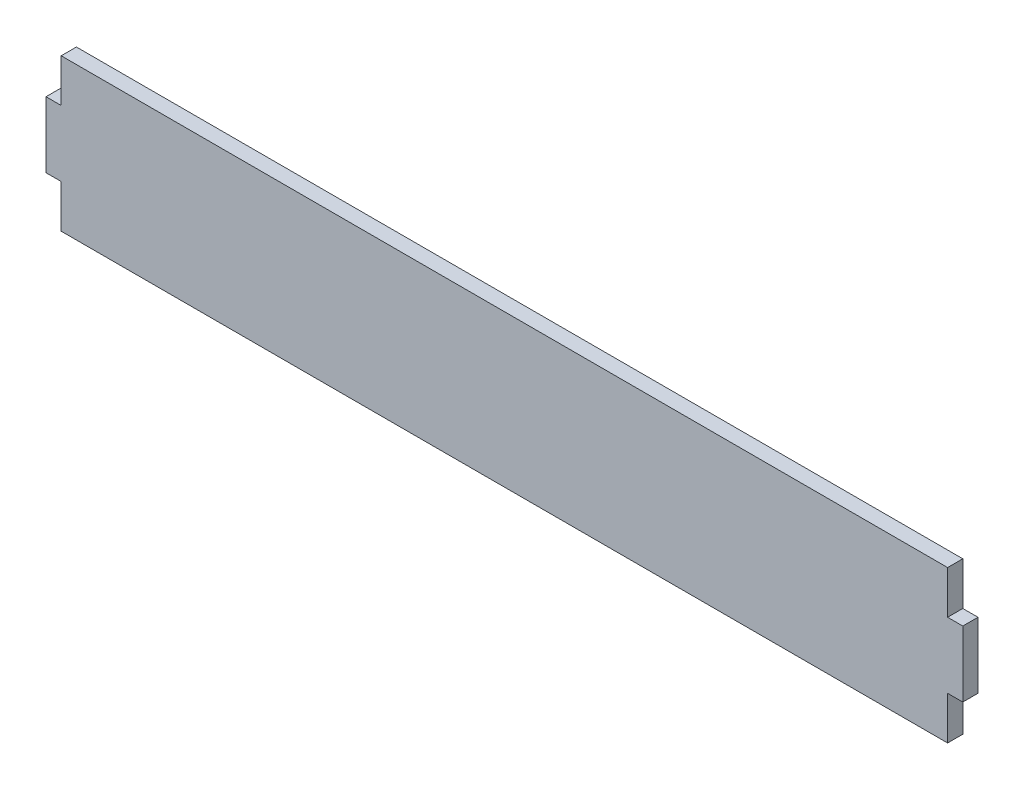
from build123d import *

# Parameters (mm, degrees)
BOSS_EXTRUDE1_DEPTH = 3


with BuildPart() as part:
    # Sketch1 → Boss-Extrude1 (new body)
    with BuildSketch(Plane.XY):
        Polygon((3, 21.5), (3, 30), (178, 30), (178, 21.5), (181, 21.5), (181, 8.5), (178, 8.5), (178, 0), (3, 0), (3, 8.5), (0, 8.5), (0, 21.5), align=None)
    extrude(amount=BOSS_EXTRUDE1_DEPTH)


solid = part.part
